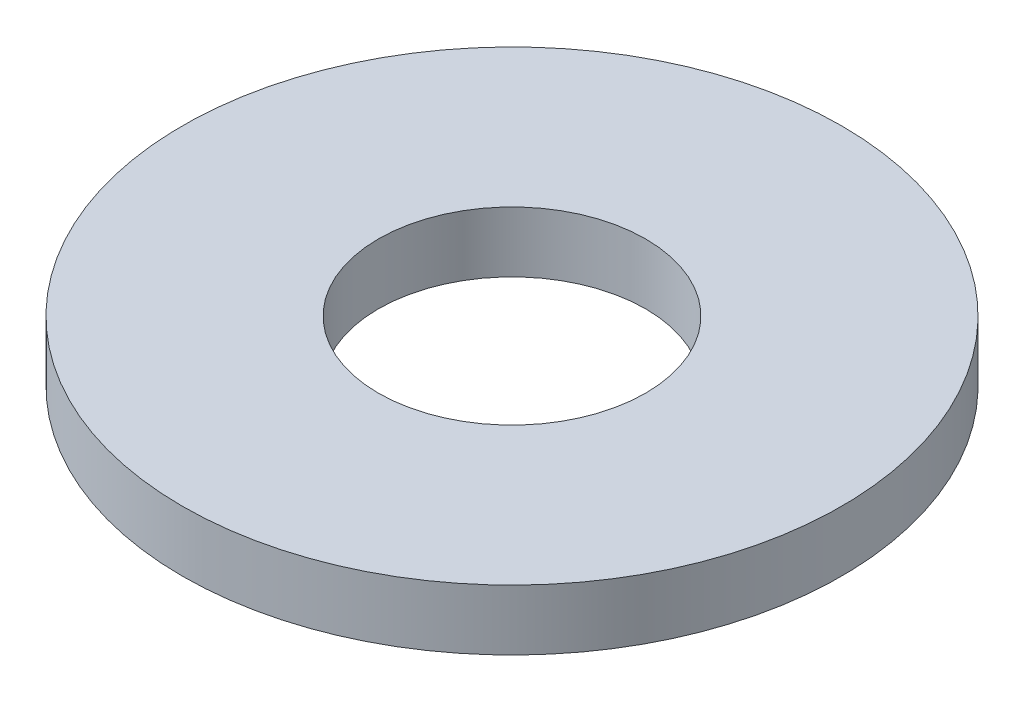
from build123d import *

# Parameters (mm, degrees)
SKETCH1_R           = 92.5
BOSS_EXTRUDE1_DEPTH = 17
SKETCH2_R           = 37.5
CUT_EXTRUDE1_DEPTH  = 132.914745196


with BuildPart() as part:
    # Sketch1 → Boss-Extrude1 (new body)
    with BuildSketch(Plane(origin=(0, 0, 0), x_dir=(1, 0, 0), z_dir=(0, 1, 0))):
        Circle(SKETCH1_R)
    extrude(amount=BOSS_EXTRUDE1_DEPTH)

    # Sketch2 → Cut-Extrude1 (cut, through all)
    with BuildSketch(Plane(origin=(0, 0, 0), x_dir=(1, 0, 0), z_dir=(0, 1, 0))):
        Circle(SKETCH2_R)
    extrude(amount=CUT_EXTRUDE1_DEPTH, mode=Mode.SUBTRACT)


solid = part.part
